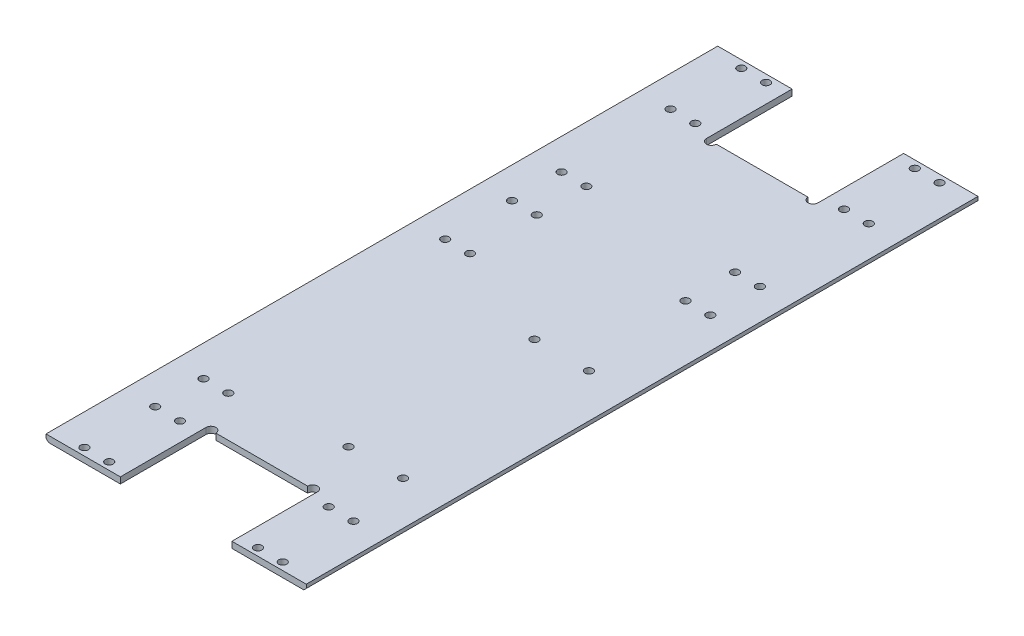
from build123d import *

# Parameters (mm, degrees)
SKETCH_1_W          = 105
SKETCH_1_H          = 271
EXTRUDE_1_DEPTH     = 2.5
SKETCH_2_R          = 1.6
CUT_EXTRUDE_1_DEPTH = 10
CHAMFER_4_SIZE      = 1
SKETCH_3_W          = 45
SKETCH_3_H          = 34.55
CUT_EXTRUDE_2_DEPTH = 10
SKETCH_4_R          = 2
CUT_EXTRUDE_3_DEPTH = 10
SKETCH_5_R          = 1.6
CUT_EXTRUDE_4_DEPTH = 10
SKETCH_6_R          = 1.6
CUT_EXTRUDE_5_DEPTH = 10


with BuildPart() as part:
    # 草图1 → 凸台-拉伸1 (new body)
    with BuildSketch(Plane(origin=(0, 0, 0), x_dir=(1, 0, 0), z_dir=(0, 1, 0))):
        Rectangle(SKETCH_1_W, SKETCH_1_H)
    extrude(amount=EXTRUDE_1_DEPTH)

    # 草图2 → 切除-拉伸1 (cut)
    with BuildSketch(Plane(origin=(0, 2.5, 0), x_dir=(1, 0, 0), z_dir=(0, 1, 0))):
        with Locations((13.000000181, -3.95)):
            Circle(SKETCH_2_R)
        with Locations((35, -3.95)):
            Circle(SKETCH_2_R)
        with Locations((35, -78.95)):
            Circle(SKETCH_2_R)
        with Locations((13.000000181, -78.95)):
            Circle(SKETCH_2_R)
    extrude(amount=-CUT_EXTRUDE_1_DEPTH, mode=Mode.SUBTRACT)

    # 倒角4
    chamfer_4_edges = [part.edges().sort_by_distance(p)[0] for p in [
        (52.5, 0, 0),
        (-52.5, 0, 0),
    ]]
    chamfer(chamfer_4_edges, length=CHAMFER_4_SIZE)

    # 草图3 → 切除-拉伸2 (cut)
    with BuildSketch(Plane.XZ):
        with Locations((0, 118.225)):
            Rectangle(SKETCH_3_W, SKETCH_3_H)
        with Locations((0, -118.225)):
            Rectangle(SKETCH_3_W, SKETCH_3_H)
    extrude(amount=-CUT_EXTRUDE_2_DEPTH, mode=Mode.SUBTRACT)

    # 草图4 → 切除-拉伸3 (cut)
    with BuildSketch(Plane.XZ):
        with Locations((20.5, -100.95)):
            Circle(SKETCH_4_R)
        with Locations((-20.5, -100.95)):
            Circle(SKETCH_4_R)
        with Locations((-20.5, 100.95)):
            Circle(SKETCH_4_R)
        with Locations((20.5, 100.95)):
            Circle(SKETCH_4_R)
    extrude(amount=-CUT_EXTRUDE_3_DEPTH, mode=Mode.SUBTRACT)

    # 草图5 → 切除-拉伸4 (cut)
    with BuildSketch(Plane(origin=(0, 2.5, 0), x_dir=(1, 0, 0), z_dir=(0, 1, 0))):
        with Locations((-40, 103.95)):
            Circle(SKETCH_5_R)
        with Locations((-30, 103.95)):
            Circle(SKETCH_5_R)
        with Locations((-40, 132.5)):
            Circle(SKETCH_5_R)
        with Locations((-30, 132.5)):
            Circle(SKETCH_5_R)
        with Locations((30, 132.5)):
            Circle(SKETCH_5_R)
        with Locations((40, 132.5)):
            Circle(SKETCH_5_R)
        with Locations((30, 103.95)):
            Circle(SKETCH_5_R)
        with Locations((40, 103.95)):
            Circle(SKETCH_5_R)
        with Locations((40, -103.95)):
            Circle(SKETCH_5_R)
        with Locations((30, -103.95)):
            Circle(SKETCH_5_R)
        with Locations((40, -132.5)):
            Circle(SKETCH_5_R)
        with Locations((30, -132.5)):
            Circle(SKETCH_5_R)
        with Locations((-30, -132.5)):
            Circle(SKETCH_5_R)
        with Locations((-40, -132.5)):
            Circle(SKETCH_5_R)
        with Locations((-30, -103.95)):
            Circle(SKETCH_5_R)
        with Locations((-40, -103.95)):
            Circle(SKETCH_5_R)
    extrude(amount=-CUT_EXTRUDE_4_DEPTH, mode=Mode.SUBTRACT)

    # 草图6 → 切除-拉伸5 (cut)
    with BuildSketch(Plane(origin=(0, 2.5, 0), x_dir=(1, 0, 0), z_dir=(0, 1, 0))):
        with Locations((40, 60)):
            Circle(SKETCH_6_R)
        with Locations((30, 60)):
            Circle(SKETCH_6_R)
        with Locations((40, 40)):
            Circle(SKETCH_6_R)
        with Locations((30, 40)):
            Circle(SKETCH_6_R)
        with Locations((-30, 40)):
            Circle(SKETCH_6_R)
        with Locations((-40, 40)):
            Circle(SKETCH_6_R)
        with Locations((-30, 60)):
            Circle(SKETCH_6_R)
        with Locations((-40, 60)):
            Circle(SKETCH_6_R)
        with Locations((-30, -84.45)):
            Circle(SKETCH_6_R)
        with Locations((-40, -84.45)):
            Circle(SKETCH_6_R)
        with Locations((-30, 13.05)):
            Circle(SKETCH_6_R)
        with Locations((-40, 13.05)):
            Circle(SKETCH_6_R)
    extrude(amount=-CUT_EXTRUDE_5_DEPTH, mode=Mode.SUBTRACT)


solid = part.part
